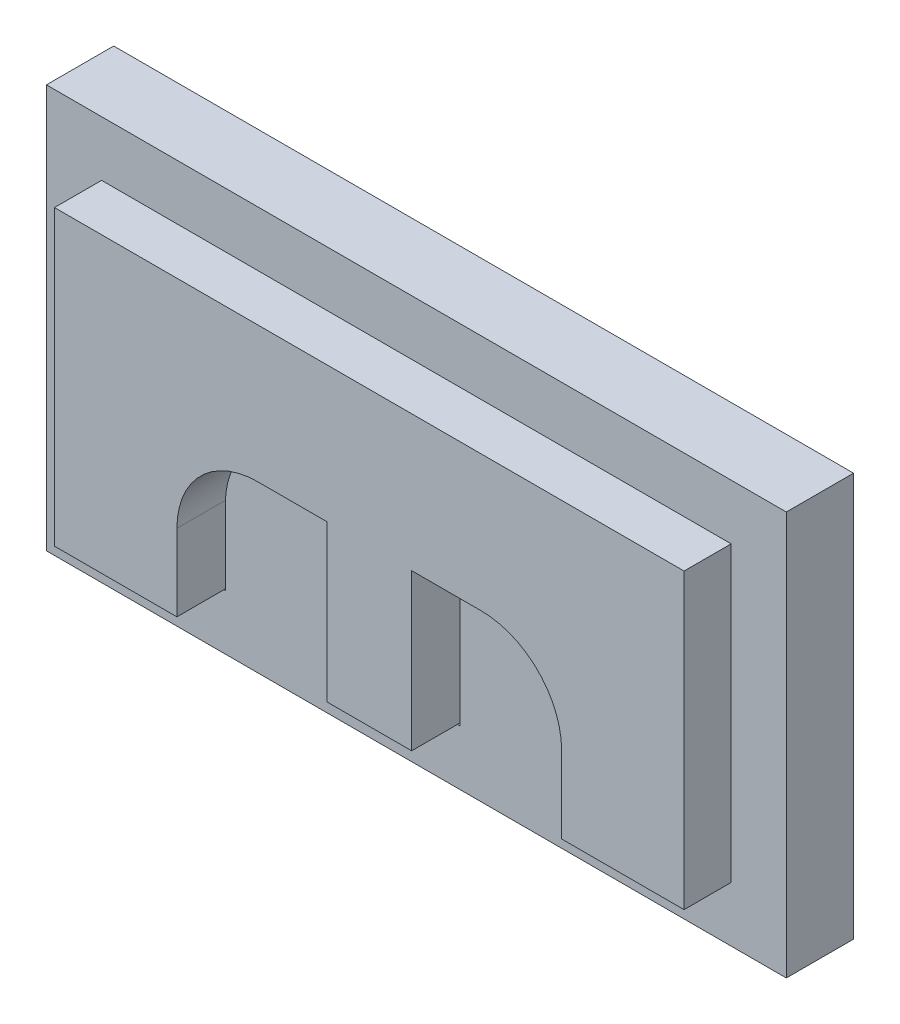
from build123d import *

# Parameters (mm, degrees)
SKETCH1_W            = 110
SKETCH1_H            = 60
BOSS_EXTRUDE1_DEPTH  = 10
SKETCH2_W            = 93.6
SKETCH2_H            = 43.6
BOSS_EXTRUDE3_DEPTH  = 7
SKETCH3_W            = 22.1
SKETCH3_H            = 23.4
CUT_EXTRUDE1_DEPTH   = 7
FILLET1_R            = 12
FILLET1_OF_MIRROR1_R = 12
CUT_EXTRUDE3_START   = -10
CUT_EXTRUDE3_DEPTH   = 10


# Read off the part's stored shape, not the designer's step: Cut-Extrude3
with BuildPart() as part:
    # Sketch1 → Boss-Extrude1 (new body)
    with BuildSketch(Plane.XY):
        with Locations((55, 30)):
            Rectangle(SKETCH1_W, SKETCH1_H)
    extrude(amount=BOSS_EXTRUDE1_DEPTH)

    # Sketch2 → Boss-Extrude3 (add)
    with BuildSketch(Plane.XY.offset(10)):
        with Locations((55, 30)):
            Rectangle(SKETCH2_W, SKETCH2_H)
    extrude(amount=BOSS_EXTRUDE3_DEPTH)

    # Sketch3 → Cut-Extrude1 (cut)
    with BuildSketch(Plane.XY.offset(17)):
        with Locations((37.45, 19.9)):
            Rectangle(SKETCH3_W, SKETCH3_H)
    cut_extrude1 = extrude(amount=-CUT_EXTRUDE1_DEPTH, mode=Mode.SUBTRACT)

    # Fillet1
    fillet1_edges = [part.edges().sort_by_distance(p)[0] for p in [
        (26.4, 31.6, 13.5),
    ]]
    fillet(fillet1_edges, radius=FILLET1_R)

    # Mirror1: Cut-Extrude1 across plane
    add(cut_extrude1.mirror(Plane(origin=(55, 0, 0), x_dir=(0, 0, 1), z_dir=(1, 0, 0))), mode=Mode.SUBTRACT)

    # Fillet1 of Mirror1
    fillet1_of_mirror1_edges = [part.edges().sort_by_distance(p)[0] for p in [
        (83.6, 31.6, 13.5),
    ]]
    fillet(fillet1_of_mirror1_edges, radius=FILLET1_OF_MIRROR1_R)

    # Cut-Extrude3 outline → Cut-Extrude3 (cut)
    with BuildSketch(Plane.XY.offset(17).offset(CUT_EXTRUDE3_START)):
        with BuildLine():
            Line((61.3, 31.6), (61.3, 8.4))
            Line((61.3, 8.4), (55, 8.4))
            Line((55, 8.4), (55, 8.2))
            Line((55, 8.2), (61.5, 8.2))
            Line((61.5, 8.2), (61.5, 31.4))
            Line((61.5, 31.4), (71.4, 31.4))
            ThreePointArc((71.4, 31.4), (79.885281374, 27.885281374), (83.4, 19.4))
            Line((83.4, 19.4), (83.4, 8.2))
            Line((83.4, 8.2), (83.6, 8.2))
            Line((83.6, 8.2), (83.6, 19.6))
            ThreePointArc((83.6, 19.6), (80.085281374, 28.085281374), (71.6, 31.6))
            Line((71.6, 31.6), (61.3, 31.6))
        make_face()
    cut_extrude3 = extrude(amount=CUT_EXTRUDE3_DEPTH, mode=Mode.SUBTRACT)

    # Mirror2: Cut-Extrude3 across plane
    add(cut_extrude3.mirror(Plane(origin=(55, 0, 0), x_dir=(0, 0, 1), z_dir=(1, 0, 0))), mode=Mode.SUBTRACT)


solid = part.part
